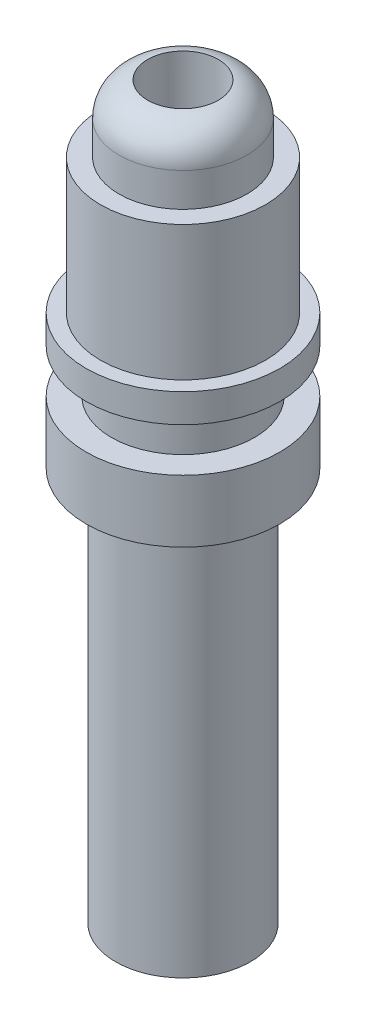
from build123d import *

# Parameters (mm, degrees)
SKETCH1_R           = 5.75
BOSS_EXTRUDE1_DEPTH = 16
SKETCH2_OUTSIDE_W   = 18.062
SKETCH2_OUTSIDE_H   = 18.062
SKETCH2_OUTSIDE_R   = 4.9
CUT_EXTRUDE1_DEPTH  = 8
SKETCH3_R           = 3.8
BOSS_EXTRUDE2_DEPTH = 4
FILLET2_R           = 2
SKETCH4_R           = 4
BOSS_EXTRUDE3_DEPTH = 23.4
SKETCH12_W          = 1.5
SKETCH12_H          = 2.6
CUT_EXTRUDE2_REACH  = 46.155
SKETCH5_R           = 1.25
SKETCH13_R          = 2.1
CUT_EXTRUDE3_DEPTH  = 12


with BuildPart() as part:
    # Sketch1 → Boss-Extrude1 (new body)
    with BuildSketch(Plane(origin=(0, 0, 0), x_dir=(1, 0, 0), z_dir=(0, 1, 0))):
        Circle(SKETCH1_R)
    extrude(amount=BOSS_EXTRUDE1_DEPTH)

    # Sketch2 outside → Cut-Extrude1 (cut)
    with BuildSketch(Plane(origin=(0, 16, 0), x_dir=(1, 0, 0), z_dir=(0, 1, 0))):
        Rectangle(SKETCH2_OUTSIDE_W, SKETCH2_OUTSIDE_H)
        Circle(SKETCH2_OUTSIDE_R, mode=Mode.SUBTRACT)
    extrude(amount=-CUT_EXTRUDE1_DEPTH, mode=Mode.SUBTRACT)

    # Sketch3 → Boss-Extrude2 (add)
    with BuildSketch(Plane(origin=(0, 16, 0), x_dir=(1, 0, 0), z_dir=(0, 1, 0))):
        Circle(SKETCH3_R)
    extrude(amount=BOSS_EXTRUDE2_DEPTH)

    # Fillet2
    fillet2_edges = [part.edges().sort_by_distance(p)[0] for p in [
        (-3.8, 20, 0),
    ]]
    fillet(fillet2_edges, radius=FILLET2_R)

    # Sketch4 → Boss-Extrude3 (add)
    with BuildSketch(Plane.XZ):
        Circle(SKETCH4_R)
    extrude(amount=BOSS_EXTRUDE3_DEPTH)

    # Sketch12 → Cut-Revolve2 (revolve, cut)
    with BuildSketch(Plane(origin=(0, 0, 0), x_dir=(0, 0, -1), z_dir=(1, 0, 0))):
        with Locations((-5, 5)):
            Rectangle(SKETCH12_W, SKETCH12_H)
    revolve(axis=Axis((0, 8, 0), (0, -1, 0)), mode=Mode.SUBTRACT)

    # Sketch5 → Cut-Extrude2 (cut, up to next)
    with BuildSketch(Plane.XZ.offset(23.4), mode=Mode.PRIVATE) as cut_extrude2_sk1:
        Circle(SKETCH5_R)
    cut_extrude2_tool1 = extrude(cut_extrude2_sk1.sketch, amount=-CUT_EXTRUDE2_REACH, mode=Mode.PRIVATE) & part.part
    add(cut_extrude2_tool1.solids().sort_by_distance((0, -23.4, 0))[0], mode=Mode.SUBTRACT)

    # Sketch13 → Cut-Extrude3 (cut)
    with BuildSketch(Plane(origin=(0, 20, 0), x_dir=(1, 0, 0), z_dir=(0, 1, 0))):
        Circle(SKETCH13_R)
    extrude(amount=-CUT_EXTRUDE3_DEPTH, mode=Mode.SUBTRACT)


solid = part.part
